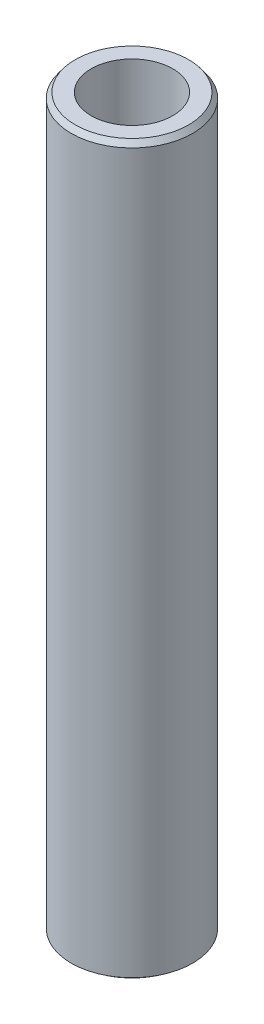
from build123d import *
from OCP.BRepFilletAPI import BRepFilletAPI_MakeChamfer

# Parameters (mm, degrees)
SKETCH1_R           = 50
BOSS_EXTRUDE1_DEPTH = 600
SKETCH2_R           = 33.606366666
CUT_EXTRUDE1_DEPTH  = 605.15229868
CHAMFER1_SIZE       = 4.425553968
CHAMFER1_SIZE2      = 3.326935154


with BuildPart() as part:
    # Sketch1 → Boss-Extrude1 (new body)
    with BuildSketch(Plane(origin=(0, 0, 0), x_dir=(1, 0, 0), z_dir=(0, 1, 0))):
        Circle(SKETCH1_R)
    extrude(amount=BOSS_EXTRUDE1_DEPTH)

    # Sketch2 → Cut-Extrude1 (cut, through all)
    with BuildSketch(Plane(origin=(0, 0, 0), x_dir=(1, 0, 0), z_dir=(0, 1, 0))):
        Circle(SKETCH2_R)
    extrude(amount=CUT_EXTRUDE1_DEPTH, mode=Mode.SUBTRACT)

    # Chamfer1: one chamfer whose edges measure the first distance from different faces: ONE call of the kernel's chamfer builder (chamfer() names one face for all edges)
    chamfer1_edges_1 = [part.edges().sort_by_distance(p)[0] for p in [
        (-50, 600, 0),
    ]]
    chamfer1_side_1 = [part.faces().sort_by_distance(p)[0] for p in [
        (-50, 300, 0),
    ]]
    chamfer1_edges_2 = [part.edges().sort_by_distance(p)[0] for p in [
        (-50, 0, 0),
    ]]
    chamfer1_side_2 = [part.faces().sort_by_distance(p)[0] for p in [
        (-48.585786438, 0, 0),
    ]]
    chamfer1 = BRepFilletAPI_MakeChamfer(part.part.solid().wrapped)
    for e in chamfer1_edges_1:
        chamfer1.Add(CHAMFER1_SIZE, CHAMFER1_SIZE2, e.wrapped, chamfer1_side_1[0].wrapped)  # the first distance lies on this face
    for e in chamfer1_edges_2:
        chamfer1.Add(CHAMFER1_SIZE, CHAMFER1_SIZE2, e.wrapped, chamfer1_side_2[0].wrapped)  # the first distance lies on this face
    add(Compound.cast(chamfer1.Shape()), mode=Mode.REPLACE)


solid = part.part
